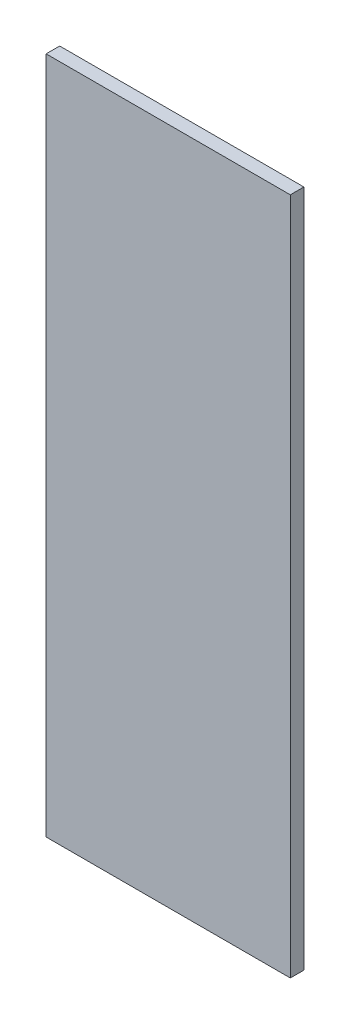
from build123d import *

# Parameters (mm, degrees)
SKETCH_1_W      = 90
SKETCH_1_H      = 250
EXTRUDE_1_DEPTH = 5


with BuildPart() as part:
    # 스케치1 → 보스-돌출1 (new body)
    with BuildSketch(Plane.XY):
        Rectangle(SKETCH_1_W, SKETCH_1_H)
    extrude(amount=EXTRUDE_1_DEPTH)


solid = part.part
